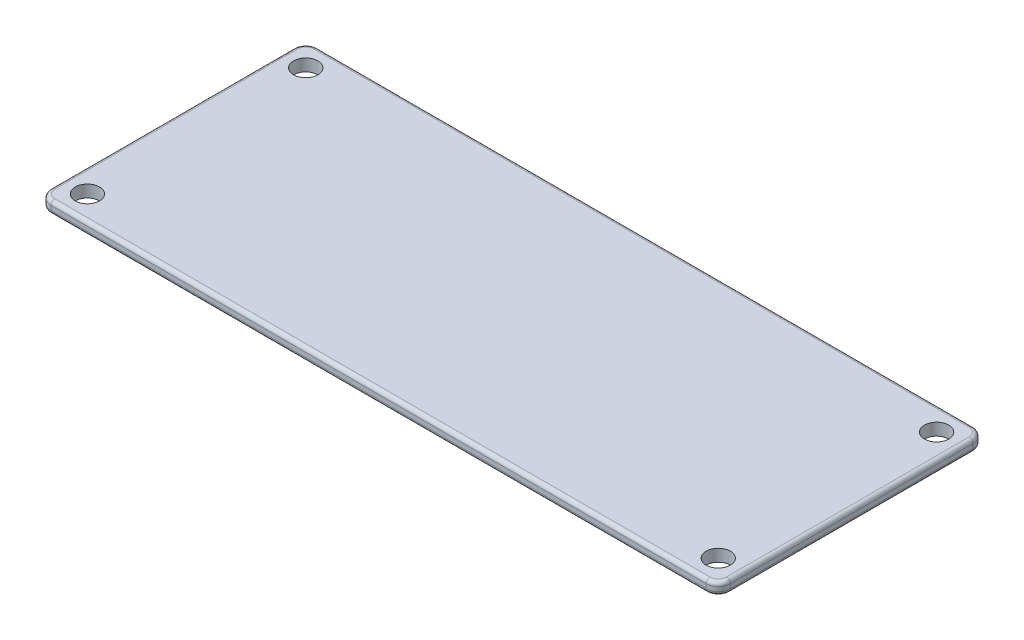
from build123d import *

# Parameters (mm, degrees)
SKETCH1_W           = 177.8
SKETCH1_H           = 69.85
BOSS_EXTRUDE1_DEPTH = 3.175
SKETCH2_R           = 3.175
CUT_EXTRUDE1_DEPTH  = 96.56697259
FILLET1_R           = 3.175
FILLET2_R           = 1.000000032


with BuildPart() as part:
    # Sketch1 → Boss-Extrude1 (new body)
    with BuildSketch(Plane(origin=(0, 0, 0), x_dir=(1, 0, 0), z_dir=(0, 1, 0))):
        Rectangle(SKETCH1_W, SKETCH1_H)
    extrude(amount=BOSS_EXTRUDE1_DEPTH)

    # Sketch2 → Cut-Extrude1 (cut, through all)
    with BuildSketch(Plane(origin=(0, 3.175, 0), x_dir=(1, 0, 0), z_dir=(0, 1, 0))):
        with Locations((-82.55, 28.575)):
            Circle(SKETCH2_R)
        with Locations((-82.55, -28.575)):
            Circle(SKETCH2_R)
        with Locations((82.55, 28.575)):
            Circle(SKETCH2_R)
        with Locations((82.55, -28.575)):
            Circle(SKETCH2_R)
    extrude(amount=-CUT_EXTRUDE1_DEPTH, mode=Mode.SUBTRACT)

    # Fillet1
    fillet1_edges = [part.edges().sort_by_distance(p)[0] for p in [
        (88.9, 1.5875, -34.925),
        (88.9, 1.5875, 34.925),
        (-88.9, 1.5875, -34.925),
        (-88.9, 1.5875, 34.925),
    ]]
    fillet(fillet1_edges, radius=FILLET1_R)

    # Fillet2
    fillet2_edges = [part.edges().sort_by_distance(p)[0] for p in [
        (-87.97006403, 0, 33.99506403),
        (-88.9, 0, 0),
        (-87.97006403, 0, -33.99506403),
        (0, 0, -34.925),
        (87.97006403, 0, -33.99506403),
        (88.9, 0, 0),
        (87.97006403, 0, 33.99506403),
        (-87.97006403, 3.175, 33.99506403),
        (-88.9, 3.175, 0),
        (-87.97006403, 3.175, -33.99506403),
        (0, 3.175, -34.925),
        (87.97006403, 3.175, -33.99506403),
        (88.9, 3.175, 0),
        (87.97006403, 3.175, 33.99506403),
        (0, 0, 34.925),
        (0, 3.175, 34.925),
    ]]
    fillet(fillet2_edges, radius=FILLET2_R)


solid = part.part
